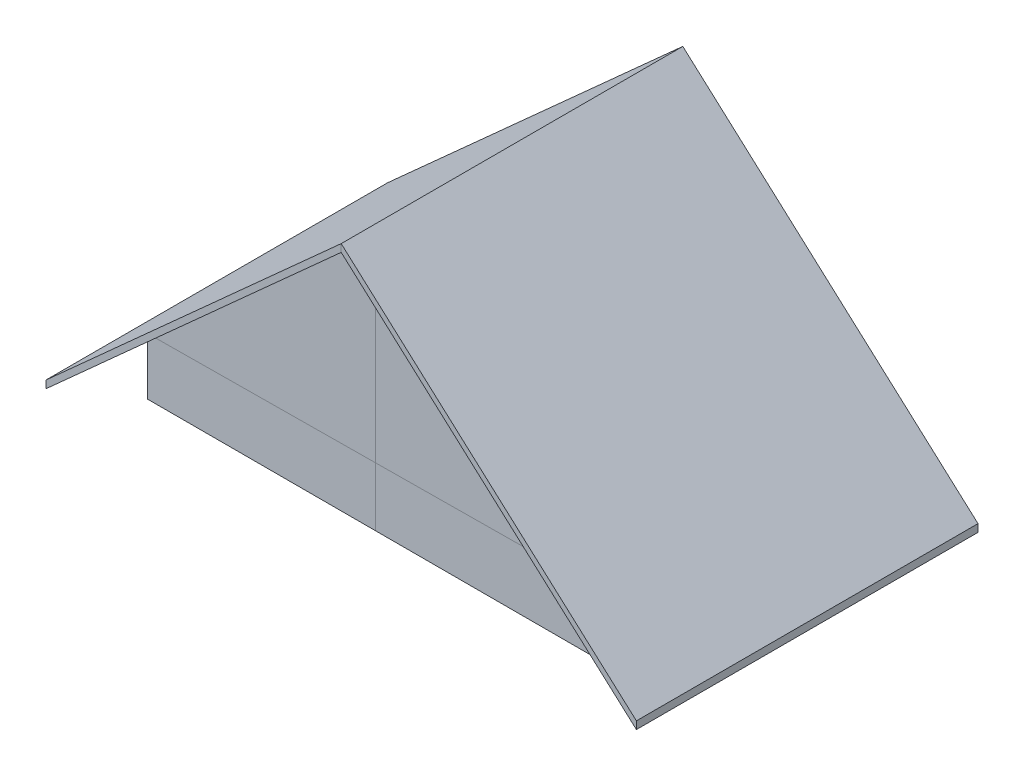
from build123d import *

# Parameters (mm, degrees)
SKETCH1_W           = 152.4
SKETCH1_H           = 101.6
SKETCH1_W_2         = 137.16
SKETCH1_H_2         = 83.82
BOSS_EXTRUDE1_DEPTH = 7.62
SKETCH1_4_W         = 152.4
SKETCH1_4_H         = 101.6
SKETCH1_4_W_2       = 137.16
SKETCH1_4_H_2       = 83.82
BOSS_EXTRUDE2_DEPTH = 12.7
BOSS_EXTRUDE3_DEPTH = 2.54
BOSS_EXTRUDE4_DEPTH = 2.54
BOSS_EXTRUDE6_START = 77.462262
BOSS_EXTRUDE6_DEPTH = 2.54
SKETCH4_W           = 146.32
SKETCH4_H           = 92.139006
SKETCH4_W_2         = 141.24
SKETCH4_H_2         = 87.059006
BOSS_EXTRUDE7_DEPTH = 3.81
BOSS_EXTRUDE5_DEPTH = 2.54


with BuildPart() as part:
    # Sketch1 → Boss-Extrude1 (new body)
    with BuildSketch(Plane(origin=(0, 0, 0), x_dir=(1, 0, 0), z_dir=(0, 1, 0))):
        with Locations((24.319149, -29.205059)):
            Rectangle(SKETCH1_W, SKETCH1_H)
        with Locations((24.319149, -27.935059)):
            Rectangle(SKETCH1_W_2, SKETCH1_H_2, mode=Mode.SUBTRACT)
    extrude(amount=BOSS_EXTRUDE1_DEPTH)

    # Sketch1<4> → Boss-Extrude2 (add)
    with BuildSketch(Plane(origin=(0, 0, 0), x_dir=(1, 0, 0), z_dir=(0, 1, 0))):
        with Locations((24.319149, -29.205059)):
            Rectangle(SKETCH1_4_W, SKETCH1_4_H)
        with Locations((24.319149, -27.935059)):
            Rectangle(SKETCH1_4_W_2, SKETCH1_4_H_2, mode=Mode.SUBTRACT)
    extrude(amount=-BOSS_EXTRUDE2_DEPTH)

    # 3DSketch1 → Boss-Extrude3 (add, along a direction that is not the sketch's normal)
    with BuildSketch(Plane(origin=(-74.458629, -12.7, 91.435059), x_dir=(0.5635274514996128, 0.5071747063496513, -0.6520817653066956), z_dir=(0.6689647316224498, -0.7432941462471663, 0))):
        Polygon((0, 0), (100.751821, 86.65639), (175.284767, 0), (74.532946, -86.65639), align=None)
    extrude(amount=BOSS_EXTRUDE3_DEPTH, dir=(0, -1, 0))

    # 3DSketch2 → Boss-Extrude4 (add, along a direction that is not the sketch's normal)
    with BuildSketch(Plane(origin=(24.319149, 76.2, 91.435059), x_dir=(0.563527451499613, -0.5071747063496519, -0.6520817653066951), z_dir=(-0.6689647316224497, -0.7432941462471663, 0))):
        Polygon((0, 0), (100.751821, 86.65639), (175.284767, 0), (74.532946, -86.65639), align=None)
    extrude(amount=BOSS_EXTRUDE4_DEPTH, dir=(0, -1, 0))


with BuildPart() as boss_extrude6_tool:
    # Boss-Extrude6: read off the stored shape, not the designer's step
    # Boss-Extrude6 outline → Boss-Extrude6 (new body)
    with BuildSketch(Plane(origin=(0, 0, 0), x_dir=(0.999999999993782, 1.4508726198126203e-09, -3.5264782604969394e-06), z_dir=(3.526478558957771e-06, -0.00041142249854835217, 0.9999999153595424)).offset(BOSS_EXTRUDE6_START)):
        Polygon((97.696645, 7.652915), (24.318867, 73.692921), (-50.470022, 6.382915), (97.574726, 7.65187), (97.696654, 7.65187), (97.695503, 7.652905), align=None)
    extrude(amount=BOSS_EXTRUDE6_DEPTH)


with BuildPart() as part_1:
    add(part.part)


with BuildPart() as part_2:
    # Boss-Extrude6: joined with boss_extrude6_tool
    add(part_1.part.fuse(boss_extrude6_tool.part, tol=0.00001))

    # Sketch4 → Boss-Extrude7 (add)
    with BuildSketch(Plane.XZ.offset(12.7)):
        with Locations((24.319149, 28.672676)):
            Rectangle(SKETCH4_W, SKETCH4_H)
        with Locations((24.319149, 28.672676)):
            Rectangle(SKETCH4_W_2, SKETCH4_H_2, mode=Mode.SUBTRACT)
    extrude(amount=BOSS_EXTRUDE7_DEPTH)

    # 3DSketch6 → Boss-Extrude5 (add)
    with BuildSketch(Plane(origin=(97.696927, 7.62, -21.594941), x_dir=(-1, 0, 0), z_dir=(0, 0, -1))):
        Polygon((0, 0), (146.755556, 0), (73.377778, 66.04), align=None)
    extrude(amount=-BOSS_EXTRUDE5_DEPTH)


with BuildPart() as body_2:
    # Split1: the piece on the far side of the plane
    add(part_2.part)
    split(bisect_by=Plane(origin=(24.319149, 0, 0), x_dir=(0, 0, 1), z_dir=(1, 0, 0)), keep=Keep.BOTTOM)


with BuildPart() as part_3:
    add(part_2.part)

    # Split1
    split(bisect_by=Plane(origin=(24.319149, 0, 0), x_dir=(0, 0, 1), z_dir=(1, 0, 0)), keep=Keep.TOP)


solid = Compound([body_2.part, part_3.part])
